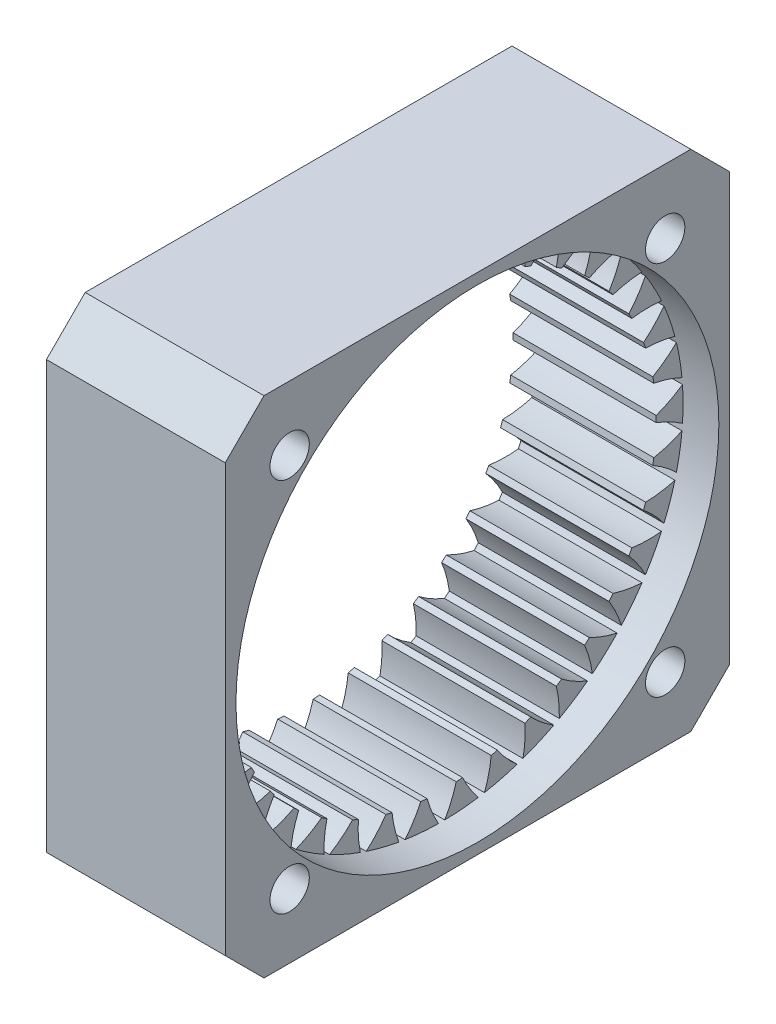
from build123d import *

# Parameters (mm, degrees)
INTERNAL_START                  = -35.181990702
INTERNAL_SPUR_GEAR_AM_OUTLINE_R = 21
INTERNAL_SPUR_GEAR_AM_DEPTH     = 12
BOSS_EXTRUDE1_START             = -12
SKETCH1_W                       = 42.3
SKETCH1_H                       = 42.3
SKETCH1_R                       = 21
BOSS_EXTRUDE1_DEPTH             = 12
SKETCH2_W                       = 42.3
SKETCH2_H                       = 42.3
SKETCH2_R                       = 20.251
BOSS_EXTRUDE2_DEPTH             = 3
SKETCH3_R                       = 1.65
CUT_EXTRUDE1_DEPTH              = 48.238005738


# Read off the part's stored shape, not the designer's step: internal spur gear_am
with BuildPart() as part:
    # internal spur gear_am outline → internal spur gear_am (new body)
    with BuildSketch(Plane.YZ.offset(INTERNAL_START)):
        with Locations((5.856405703, 14.58630139)):
            Circle(INTERNAL_SPUR_GEAR_AM_OUTLINE_R)
        with BuildLine():
            ThreePointArc((26.105715661, 14.324677181), (24.991816886, 13.769768567), (23.814940473, 13.365224431))
            ThreePointArc((23.814940473, 13.365224431), (23.794926577, 13.099873172), (23.770992127, 12.834846779))
            ThreePointArc((23.770992127, 12.834846779), (24.865231704, 12.242112607), (25.872603396, 11.511430511))
            ThreePointArc((25.872603396, 11.511430511), (25.831208458, 11.253096343), (25.786479537, 10.995318518))
            ThreePointArc((25.786479537, 10.995318518), (24.596437933, 10.631319847), (23.369026804, 10.426000657))
            ThreePointArc((23.369026804, 10.426000657), (23.30561049, 10.167562622), (23.238380564, 9.910090324))
            ThreePointArc((23.238380564, 9.910090324), (24.220135302, 9.145334359), (25.093501436, 8.258809883))
            ThreePointArc((25.093501436, 8.258809883), (25.010150665, 8.010812439), (24.923602952, 7.763912507))
            ThreePointArc((24.923602952, 7.763912507), (23.689879753, 7.600752713), (22.445414483, 7.600259042))
            ThreePointArc((22.445414483, 7.600259042), (22.340325583, 7.355783747), (22.231634038, 7.112888718))
            ThreePointArc((22.231634038, 7.112888718), (23.074124226, 6.196971508), (23.789661652, 5.17878673))
            ThreePointArc((23.789661652, 5.17878673), (23.666628639, 4.947890734), (23.540622931, 4.71860348))
            ThreePointArc((23.540622931, 4.71860348), (22.296870889, 4.760733138), (21.069297248, 4.96507845))
            ThreePointArc((21.069297248, 4.96507845), (20.925402312, 4.741234544), (20.77821397, 4.519542327))
            ThreePointArc((20.77821397, 4.519542327), (21.458458672, 3.477447707), (21.996649394, 2.355376053))
            ThreePointArc((21.996649394, 2.355376053), (21.837290159, 2.147879746), (21.675263563, 1.942459529))
            ThreePointArc((21.675263563, 1.942459529), (20.455408991, 2.188729451), (19.278211988, 2.59233974))
            ThreePointArc((19.278211988, 2.59233974), (19.099436095, 2.395233101), (18.917765871, 2.200790882))
            ThreePointArc((18.917765871, 2.200790882), (19.417209785, 1.060944476), (19.763373362, -0.134406865))
            ThreePointArc((19.763373362, -0.134406865), (19.57203481, -0.312843525), (19.378406989, -0.488793376))
            ThreePointArc((19.378406989, -0.488793376), (18.21572434, -0.045100792), (17.12101484, 0.546765038))
            ThreePointArc((17.12101484, 0.546765038), (16.912234532, 0.381772221), (16.701037915, 0.219883876))
            ThreePointArc((16.701037915, 0.219883876), (17.006057513, -0.986622276), (17.150751506, -2.222647235))
            ThreePointArc((17.150751506, -2.222647235), (16.932652853, -2.367156961), (16.71270547, -2.508836994))
            ThreePointArc((16.71270547, -2.508836994), (15.638909696, -1.879824524), (14.65654852, -1.115847711))
            ThreePointArc((14.65654852, -1.115847711), (14.423458778, -1.244226132), (14.188496662, -1.36914471))
            ThreePointArc((14.188496662, -1.36914471), (14.290771804, -2.609400267), (14.230049338, -3.852383305))
            ThreePointArc((14.230049338, -3.852383305), (13.991139748, -3.959024248), (13.750872393, -4.0625698))
            ThreePointArc((13.750872393, -4.0625698), (12.795253844, -3.265395265), (11.952037245, -2.350146765))
            ThreePointArc((11.952037245, -2.350146765), (11.700996149, -2.43840896), (11.448677688, -2.522950319))
            ThreePointArc((11.448677688, -2.522950319), (11.345418575, -3.763124342), (11.080936001, -4.979160122))
            ThreePointArc((11.080936001, -4.979160122), (10.827732303, -5.045023395), (10.573698844, -5.107610015))
            ThreePointArc((10.573698844, -5.107610015), (9.762324303, -4.164018257), (9.081253031, -3.122463663))
            ThreePointArc((9.081253031, -3.122463663), (8.819108328, -3.168202071), (8.556316112, -3.210060142))
            ThreePointArc((8.556316112, -3.210060142), (8.250339384, -4.416323916), (7.789311096, -5.572242152))
            ThreePointArc((7.789311096, -5.572242152), (7.528720029, -5.595531178), (7.267849836, -5.615451664))
            ThreePointArc((7.267849836, -5.615451664), (6.622851484, -4.551181408), (6.122503388, -3.411731614))
            ThreePointArc((6.122503388, -3.411731614), (5.856405703, -3.41369861), (5.590308018, -3.411731614))
            ThreePointArc((5.590308018, -3.411731614), (5.089959922, -4.551181408), (4.444961571, -5.615451664))
            ThreePointArc((4.444961571, -5.615451664), (4.184091378, -5.595531178), (3.92350031, -5.572242152))
            ThreePointArc((3.92350031, -5.572242152), (3.462472022, -4.416323916), (3.156495294, -3.210060142))
            ThreePointArc((3.156495294, -3.210060142), (2.893703078, -3.168202071), (2.631558376, -3.122463663))
            ThreePointArc((2.631558376, -3.122463663), (1.950487104, -4.164018258), (1.139112562, -5.107610015))
            ThreePointArc((1.139112562, -5.107610015), (0.885079103, -5.045023395), (0.631875406, -4.979160122))
            ThreePointArc((0.631875406, -4.979160122), (0.367392831, -3.763124342), (0.264133718, -2.522950319))
            ThreePointArc((0.264133718, -2.522950319), (0.011815258, -2.43840896), (-0.239225838, -2.350146765))
            ThreePointArc((-0.239225838, -2.350146765), (-1.082442438, -3.265395265), (-2.038060987, -4.0625698))
            ThreePointArc((-2.038060987, -4.0625698), (-2.278328342, -3.959024248), (-2.517237932, -3.852383305))
            ThreePointArc((-2.517237932, -3.852383305), (-2.577960398, -2.609400267), (-2.475685256, -1.36914471))
            ThreePointArc((-2.475685256, -1.36914471), (-2.710647372, -1.244226132), (-2.943737114, -1.115847711))
            ThreePointArc((-2.943737114, -1.115847711), (-3.92609829, -1.879824524), (-4.999894063, -2.508836994))
            ThreePointArc((-4.999894063, -2.508836994), (-5.219841447, -2.367156961), (-5.4379401, -2.222647235))
            ThreePointArc((-5.4379401, -2.222647235), (-5.293246107, -0.986622276), (-4.988226509, 0.219883876))
            ThreePointArc((-4.988226509, 0.219883876), (-5.199423125, 0.381772221), (-5.408203434, 0.546765038))
            ThreePointArc((-5.408203434, 0.546765038), (-6.502912934, -0.045100792), (-7.665595583, -0.488793376))
            ThreePointArc((-7.665595583, -0.488793376), (-7.859223404, -0.312843525), (-8.050561956, -0.134406865))
            ThreePointArc((-8.050561956, -0.134406865), (-7.704398379, 1.060944476), (-7.204954465, 2.200790882))
            ThreePointArc((-7.204954465, 2.200790882), (-7.386624689, 2.395233101), (-7.565400581, 2.59233974))
            ThreePointArc((-7.565400581, 2.59233974), (-8.742597584, 2.188729451), (-9.962452156, 1.942459529))
            ThreePointArc((-9.962452156, 1.942459529), (-10.124478753, 2.147879745), (-10.283837987, 2.355376053))
            ThreePointArc((-10.283837987, 2.355376053), (-9.745647266, 3.477447707), (-9.065402564, 4.519542327))
            ThreePointArc((-9.065402564, 4.519542327), (-9.212590906, 4.741234544), (-9.356485841, 4.96507845))
            ThreePointArc((-9.356485841, 4.96507845), (-10.584059482, 4.760733138), (-11.827811524, 4.71860348))
            ThreePointArc((-11.827811524, 4.71860348), (-11.953817232, 4.947890734), (-12.076850245, 5.17878673))
            ThreePointArc((-12.076850245, 5.17878673), (-11.36131282, 6.196971509), (-10.518822632, 7.112888718))
            ThreePointArc((-10.518822632, 7.112888718), (-10.627514177, 7.355783747), (-10.732603077, 7.600259042))
            ThreePointArc((-10.732603077, 7.600259042), (-11.977068347, 7.600752713), (-13.210791546, 7.763912507))
            ThreePointArc((-13.210791546, 7.763912507), (-13.297339258, 8.010812439), (-13.38069003, 8.258809883))
            ThreePointArc((-13.38069003, 8.258809883), (-12.507323895, 9.145334359), (-11.525569158, 9.910090324))
            ThreePointArc((-11.525569158, 9.910090324), (-11.592799084, 10.167562622), (-11.656215397, 10.426000657))
            ThreePointArc((-11.656215397, 10.426000657), (-12.883626527, 10.631319847), (-14.07366813, 10.995318518))
            ThreePointArc((-14.07366813, 10.995318518), (-14.118397052, 11.253096343), (-14.159791989, 11.511430511))
            ThreePointArc((-14.159791989, 11.511430511), (-13.152420298, 12.242112607), (-12.058180721, 12.834846779))
            ThreePointArc((-12.058180721, 12.834846779), (-12.082115171, 13.099873172), (-12.102129066, 13.365224431))
            ThreePointArc((-12.102129066, 13.365224431), (-13.27900548, 13.769768567), (-14.392904255, 14.324677181))
            ThreePointArc((-14.392904255, 14.324677181), (-14.394594297, 14.586301391), (-14.392904255, 14.8479256))
            ThreePointArc((-14.392904255, 14.8479256), (-13.27900548, 15.402834214), (-12.102129066, 15.807378349))
            ThreePointArc((-12.102129066, 15.807378349), (-12.082115171, 16.072729609), (-12.058180721, 16.337756002))
            ThreePointArc((-12.058180721, 16.337756002), (-13.152420298, 16.930490174), (-14.159791989, 17.66117227))
            ThreePointArc((-14.159791989, 17.66117227), (-14.118397052, 17.919506438), (-14.07366813, 18.177284262))
            ThreePointArc((-14.07366813, 18.177284262), (-12.883626527, 18.541282934), (-11.656215397, 18.746602123))
            ThreePointArc((-11.656215397, 18.746602123), (-11.592799084, 19.005040159), (-11.525569158, 19.262512456))
            ThreePointArc((-11.525569158, 19.262512456), (-12.507323895, 20.027268421), (-13.38069003, 20.913792897))
            ThreePointArc((-13.38069003, 20.913792897), (-13.297339258, 21.161790341), (-13.210791546, 21.408690274))
            ThreePointArc((-13.210791546, 21.408690274), (-11.977068347, 21.571850067), (-10.732603077, 21.572343739))
            ThreePointArc((-10.732603077, 21.572343739), (-10.627514177, 21.816819034), (-10.518822632, 22.059714063))
            ThreePointArc((-10.518822632, 22.059714063), (-11.36131282, 22.975631272), (-12.076850245, 23.993816051))
            ThreePointArc((-12.076850245, 23.993816051), (-11.953817232, 24.224712047), (-11.827811524, 24.4539993))
            ThreePointArc((-11.827811524, 24.4539993), (-10.584059482, 24.411869643), (-9.356485841, 24.20752433))
            ThreePointArc((-9.356485841, 24.20752433), (-9.212590906, 24.431368236), (-9.065402564, 24.653060453))
            ThreePointArc((-9.065402564, 24.653060453), (-9.745647266, 25.695155073), (-10.283837987, 26.817226728))
            ThreePointArc((-10.283837987, 26.817226728), (-10.124478753, 27.024723036), (-9.962452156, 27.230143252))
            ThreePointArc((-9.962452156, 27.230143252), (-8.742597584, 26.98387333), (-7.565400581, 26.58026304))
            ThreePointArc((-7.565400581, 26.58026304), (-7.386624689, 26.777369679), (-7.204954465, 26.971811899))
            ThreePointArc((-7.204954465, 26.971811899), (-7.704398379, 28.111658304), (-8.050561956, 29.307009645))
            ThreePointArc((-8.050561956, 29.307009645), (-7.859223404, 29.485446305), (-7.665595583, 29.661396157))
            ThreePointArc((-7.665595583, 29.661396157), (-6.502912935, 29.217703572), (-5.408203434, 28.625837743))
            ThreePointArc((-5.408203434, 28.625837743), (-5.199423125, 28.790830559), (-4.988226509, 28.952718904))
            ThreePointArc((-4.988226509, 28.952718904), (-5.293246107, 30.159225056), (-5.4379401, 31.395250015))
            ThreePointArc((-5.4379401, 31.395250015), (-5.219841447, 31.539759741), (-4.999894063, 31.681439774))
            ThreePointArc((-4.999894063, 31.681439774), (-3.92609829, 31.052427304), (-2.943737114, 30.288450491))
            ThreePointArc((-2.943737114, 30.288450491), (-2.710647372, 30.416828912), (-2.475685256, 30.54174749))
            ThreePointArc((-2.475685256, 30.54174749), (-2.577960398, 31.782003047), (-2.517237932, 33.024986085))
            ThreePointArc((-2.517237932, 33.024986085), (-2.278328341, 33.131627028), (-2.038060987, 33.235172581))
            ThreePointArc((-2.038060987, 33.235172581), (-1.082442438, 32.437998046), (-0.239225838, 31.522749545))
            ThreePointArc((-0.239225838, 31.522749545), (0.011815257, 31.611011741), (0.264133718, 31.695553099))
            ThreePointArc((0.264133718, 31.695553099), (0.367392831, 32.935727122), (0.631875406, 34.151762902))
            ThreePointArc((0.631875406, 34.151762902), (0.885079103, 34.217626176), (1.139112562, 34.280212795))
            ThreePointArc((1.139112562, 34.280212795), (1.950487104, 33.336621038), (2.631558376, 32.295066444))
            ThreePointArc((2.631558376, 32.295066444), (2.893703078, 32.340804851), (3.156495294, 32.382662922))
            ThreePointArc((3.156495294, 32.382662922), (3.462472022, 33.588926696), (3.92350031, 34.744844932))
            ThreePointArc((3.92350031, 34.744844932), (4.184091378, 34.768133958), (4.444961571, 34.788054444))
            ThreePointArc((4.444961571, 34.788054444), (5.089959922, 33.723784188), (5.590308018, 32.584334394))
            ThreePointArc((5.590308018, 32.584334394), (5.856405703, 32.58630139), (6.122503388, 32.584334394))
            ThreePointArc((6.122503388, 32.584334394), (6.622851484, 33.723784189), (7.267849836, 34.788054444))
            ThreePointArc((7.267849836, 34.788054444), (7.528720029, 34.768133958), (7.789311096, 34.744844932))
            ThreePointArc((7.789311096, 34.744844932), (8.250339384, 33.588926696), (8.556316112, 32.382662922))
            ThreePointArc((8.556316112, 32.382662922), (8.819108328, 32.340804851), (9.081253031, 32.295066444))
            ThreePointArc((9.081253031, 32.295066444), (9.762324303, 33.336621038), (10.573698844, 34.280212795))
            ThreePointArc((10.573698844, 34.280212795), (10.827732303, 34.217626176), (11.080936001, 34.151762902))
            ThreePointArc((11.080936001, 34.151762902), (11.345418575, 32.935727122), (11.448677688, 31.695553099))
            ThreePointArc((11.448677688, 31.695553099), (11.700996149, 31.611011741), (11.952037245, 31.522749545))
            ThreePointArc((11.952037245, 31.522749545), (12.795253844, 32.437998046), (13.750872393, 33.235172581))
            ThreePointArc((13.750872393, 33.235172581), (13.991139748, 33.131627028), (14.230049338, 33.024986085))
            ThreePointArc((14.230049338, 33.024986085), (14.290771804, 31.782003047), (14.188496662, 30.54174749))
            ThreePointArc((14.188496662, 30.54174749), (14.423458778, 30.416828912), (14.65654852, 30.288450491))
            ThreePointArc((14.65654852, 30.288450491), (15.638909696, 31.052427304), (16.71270547, 31.681439774))
            ThreePointArc((16.71270547, 31.681439774), (16.932652853, 31.539759741), (17.150751506, 31.395250015))
            ThreePointArc((17.150751506, 31.395250015), (17.006057513, 30.159225056), (16.701037915, 28.952718904))
            ThreePointArc((16.701037915, 28.952718904), (16.912234531, 28.79083056), (17.12101484, 28.625837743))
            ThreePointArc((17.12101484, 28.625837743), (18.215724341, 29.217703572), (19.378406989, 29.661396157))
            ThreePointArc((19.378406989, 29.661396157), (19.57203481, 29.485446305), (19.763373362, 29.307009645))
            ThreePointArc((19.763373362, 29.307009645), (19.417209785, 28.111658304), (18.917765871, 26.971811899))
            ThreePointArc((18.917765871, 26.971811899), (19.099436095, 26.777369679), (19.278211988, 26.58026304))
            ThreePointArc((19.278211988, 26.58026304), (20.455408991, 26.98387333), (21.675263563, 27.230143252))
            ThreePointArc((21.675263563, 27.230143252), (21.837290159, 27.024723035), (21.996649394, 26.817226728))
            ThreePointArc((21.996649394, 26.817226728), (21.458458672, 25.695155073), (20.77821397, 24.653060453))
            ThreePointArc((20.77821397, 24.653060453), (20.925402312, 24.431368236), (21.069297248, 24.20752433))
            ThreePointArc((21.069297248, 24.20752433), (22.296870889, 24.411869643), (23.540622931, 24.4539993))
            ThreePointArc((23.540622931, 24.4539993), (23.666628639, 24.224712047), (23.789661652, 23.993816051))
            ThreePointArc((23.789661652, 23.993816051), (23.074124226, 22.975631272), (22.231634038, 22.059714063))
            ThreePointArc((22.231634038, 22.059714063), (22.340325583, 21.816819034), (22.445414483, 21.572343739))
            ThreePointArc((22.445414483, 21.572343739), (23.689879753, 21.571850067), (24.923602952, 21.408690274))
            ThreePointArc((24.923602952, 21.408690274), (25.010150665, 21.161790341), (25.093501436, 20.913792897))
            ThreePointArc((25.093501436, 20.913792897), (24.220135302, 20.027268421), (23.238380564, 19.262512456))
            ThreePointArc((23.238380564, 19.262512456), (23.30561049, 19.005040158), (23.369026804, 18.746602123))
            ThreePointArc((23.369026804, 18.746602123), (24.596437934, 18.541282934), (25.786479537, 18.177284263))
            ThreePointArc((25.786479537, 18.177284263), (25.831208458, 17.919506438), (25.872603396, 17.66117227))
            ThreePointArc((25.872603396, 17.66117227), (24.865231704, 16.930490174), (23.770992127, 16.337756002))
            ThreePointArc((23.770992127, 16.337756002), (23.794926577, 16.072729609), (23.814940473, 15.807378349))
            ThreePointArc((23.814940473, 15.807378349), (24.991816886, 15.402834214), (26.105715661, 14.8479256))
            ThreePointArc((26.105715661, 14.8479256), (26.107405703, 14.586301391), (26.105715661, 14.324677181))
        make_face(mode=Mode.SUBTRACT)
    extrude(amount=INTERNAL_SPUR_GEAR_AM_DEPTH)

    # Sketch1 → Boss-Extrude1 (add)
    with BuildSketch(Plane(origin=(-23.181990702, 0, 0), x_dir=(0, 0, -1), z_dir=(1, 0, 0)).offset(BOSS_EXTRUDE1_START)):
        with Locations((-14.58630139, 5.856405703)):
            Rectangle(SKETCH1_W, SKETCH1_H)
        with Locations((-14.58630139, 5.856405703)):
            Circle(SKETCH1_R, mode=Mode.SUBTRACT)
    extrude(amount=BOSS_EXTRUDE1_DEPTH)

    # Sketch2 → Boss-Extrude2 (add)
    with BuildSketch(Plane(origin=(-23.181990702, 0, 0), x_dir=(0, 0, -1), z_dir=(1, 0, 0))):
        with Locations((-14.58630139, 5.856405703)):
            Rectangle(SKETCH2_W, SKETCH2_H)
        with Locations(Location((-14.58630139, 5.856405703, 0), (0, 0, 176.003387021))):
            Circle(SKETCH2_R, mode=Mode.SUBTRACT)
    extrude(amount=BOSS_EXTRUDE2_DEPTH)

    # Sketch3 → Cut-Extrude1 (cut, through all)
    with BuildSketch(Plane.ZY.offset(35.181990702)):
        with Locations((30.33630139, 21.606405703)):
            Circle(SKETCH3_R)
        with Locations((30.33630139, -9.893594297)):
            Circle(SKETCH3_R)
        with Locations((-1.16369861, -9.893594297)):
            Circle(SKETCH3_R)
        with Locations((-1.16369861, 21.606405703)):
            Circle(SKETCH3_R)
        Polygon((-3.31369861, -15.293594297), (-6.56369861, -15.293594297), (-6.56369861, -12.043594297), align=None)
        Polygon((-3.31369861, 27.006405703), (-6.56369861, 23.756405703), (-6.56369861, 27.006405703), align=None)
        Polygon((35.73630139, 23.756405703), (32.48630139, 27.006405703), (35.73630139, 27.006405703), align=None)
        Polygon((32.48630139, -15.293594297), (35.73630139, -12.043594297), (35.73630139, -15.293594297), align=None)
    extrude(amount=-CUT_EXTRUDE1_DEPTH, mode=Mode.SUBTRACT)


solid = part.part
